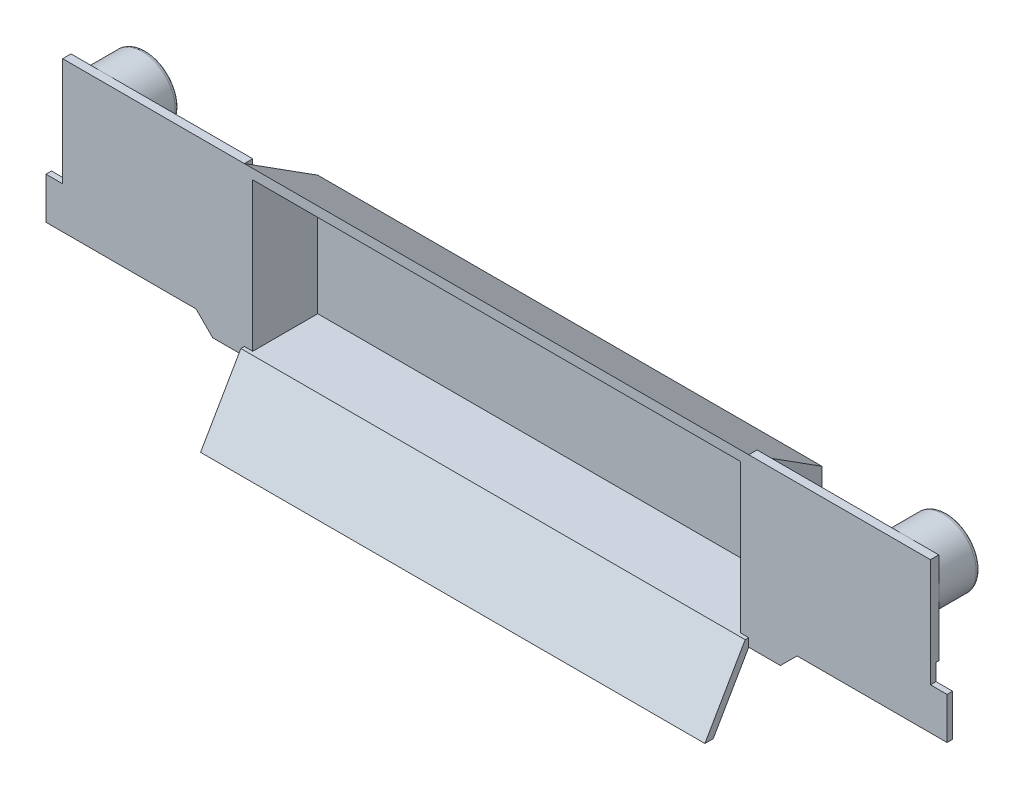
from build123d import *

# Parameters (mm, degrees)
Y_KSEKLIK_EKSTR_ZYON1_DEPTH = 1815
BO_ALTMA1_START             = 30
BO_ALTMA1_DEPTH             = 1755
Y_KSEKLIK_EKSTR_ZYON2_DEPTH = 30
IZIM3_R                     = 120
IZIM3_R_2                   = 90
Y_KSEKLIK_EKSTR_ZYON3_DEPTH = 150
IZIM4_R                     = 45
Y_KSEKLIK_EKSTR_ZYON4_DEPTH = 70
Y_KSEKLIK_EKSTR_ZYON5_DEPTH = 60
Y_KSEKLIK_EKSTR_ZYON6_DEPTH = 70
RADYUS1_R                   = 15
RADYUS2_R                   = 10
RADYUS3_R                   = 5
KES_EKSTR_ZYON1_DEPTH       = 10


# Read off the part's stored shape, not the designer's step: İç Boşaltma1
with BuildPart() as part:
    # Çizim1 → Yükseklik-Ekstrüzyon1 (new body)
    with BuildSketch(Plane(origin=(0, 0, 0), x_dir=(0, 0, -1), z_dir=(1, 0, 0))):
        Polygon((0, 0), (264, 0), (264, 432), (0, 600), (0, 30), (-12.701705922, 30), (-157.702213998, -221.14824711), (-127.68, -221.14824711), align=None)
    extrude(amount=Y_KSEKLIK_EKSTR_ZYON1_DEPTH)

    # İç Boşaltma1 outline → İç Boşaltma1 (cut)
    with BuildSketch(Plane.YZ.offset(BO_ALTMA1_START)):
        Polygon((564.440714153, 0), (30, 0), (30, -234), (415.531623244, -234), align=None)
    extrude(amount=BO_ALTMA1_DEPTH, mode=Mode.SUBTRACT)

    # Çizim2 → Yükseklik-Ekstrüzyon2 (add)
    with BuildSketch(Plane.XY):
        Polygon((1815, 600), (2469, 600), (2469, 210), (2529, 210), (2529, 60), (1989, 60), (1929, 0), (1815, 0), align=None)
        Polygon((0, 600), (0, 0), (-114, 0), (-174, 60), (-714, 60), (-714, 210), (-654, 210), (-654, 600), align=None)
    extrude(amount=-Y_KSEKLIK_EKSTR_ZYON2_DEPTH)



with BuildPart() as body_2:
    # Çizim3 → Yükseklik-Ekstrüzyon3 (new body)
    with BuildSketch(Plane(origin=(0, 0, -30), x_dir=(-1, 0, 0), z_dir=(0, 0, -1))):
        with Locations((-2349, 480)):
            Circle(IZIM3_R)
        with Locations((-2349, 480)):
            Circle(IZIM3_R_2, mode=Mode.SUBTRACT)
    extrude(amount=Y_KSEKLIK_EKSTR_ZYON3_DEPTH)


with BuildPart() as part_1:
    add(part.part)

    add(body_2.part)  # Yükseklik-Ekstrüzyon4 merges body 2
    # Çizim4 → Yükseklik-Ekstrüzyon4 (add)
    with BuildSketch(Plane(origin=(0, 0, -30), x_dir=(-1, 0, 0), z_dir=(0, 0, -1))):
        with Locations((-2349, 510)):
            Circle(IZIM4_R)
    extrude(amount=Y_KSEKLIK_EKSTR_ZYON4_DEPTH)

    # Çizim4<3> → Yükseklik-Ekstrüzyon5 (add)
    with BuildSketch(Plane(origin=(0, 0, -30), x_dir=(-1, 0, 0), z_dir=(0, 0, -1))):
        with BuildLine():
            Line((-2304, 430), (-2304, 510))
            ThreePointArc((-2304, 510), (-2349, 465), (-2394, 510))
            Line((-2394, 510), (-2394, 430))
            Line((-2394, 430), (-2349, 405))
            Line((-2349, 405), (-2304, 430))
        make_face()
    extrude(amount=Y_KSEKLIK_EKSTR_ZYON5_DEPTH)

    # Çizim5 → Yükseklik-Ekstrüzyon6 (add)
    with BuildSketch(Plane(origin=(0, 0, -30), x_dir=(-1, 0, 0), z_dir=(0, 0, -1))):
        with BuildLine():
            ThreePointArc((-2394, 440), (-2402.6187091, 424.928722701), (-2385.258427239, 425.143570688))
            Line((-2385.258427239, 425.143570688), (-2394, 430))
            Line((-2394, 430), (-2394, 440))
        make_face()
        with BuildLine():
            Line((-2394, 430), (-2385.258427239, 425.143570688))
            ThreePointArc((-2385.258427239, 425.143570688), (-2384.319717783, 427.491586917), (-2384, 430))
            ThreePointArc((-2384, 430), (-2386.928932188, 437.071067812), (-2394, 440))
            Line((-2394, 440), (-2394, 430))
        make_face()
        with BuildLine():
            ThreePointArc((-2312.741572761, 425.143570688), (-2301.491586917, 420.319717783), (-2294, 430))
            ThreePointArc((-2294, 430), (-2296.928932188, 437.071067812), (-2304, 440))
            Line((-2304, 440), (-2304, 430))
            Line((-2304, 430), (-2312.741572761, 425.143570688))
        make_face()
        with BuildLine():
            Line((-2304, 430), (-2304, 440))
            ThreePointArc((-2304, 440), (-2312.6187091, 435.071277299), (-2312.741572761, 425.143570688))
            Line((-2312.741572761, 425.143570688), (-2304, 430))
        make_face()
    extrude(amount=Y_KSEKLIK_EKSTR_ZYON6_DEPTH)

    # Radyus1
    radyus1_edges = [part_1.edges().sort_by_distance(p)[0] for p in [
        (2469, 480, -180),
    ]]
    fillet(radyus1_edges, radius=RADYUS1_R)

    # Radyus2
    radyus2_edges = [part_1.edges().sort_by_distance(p)[0] for p in [
        (2439, 480, -180),
    ]]
    fillet(radyus2_edges, radius=RADYUS2_R)

    # Radyus3
    radyus3_edges = [part_1.edges().sort_by_distance(p)[0] for p in [
        (2402.741572761, 434.856429312, -100),
        (2304, 420, -100),
        (2394, 510, -100),
    ]]
    fillet(radyus3_edges, radius=RADYUS3_R)

    # Aynalama17: part across plane


with BuildPart() as part_2:
    add(part_1.part)
    add(part_1.part.mirror(Plane.ZY.offset(-907.5)))

    # Çizim6 → Kes-Ekstrüzyon1 (cut)
    with BuildSketch(Plane(origin=(0, 0, -30), x_dir=(-1, 0, 0), z_dir=(0, 0, -1))):
        Polygon((-1989, 270), (-2469, 270), (-2469, 210), (-2529, 210), (-2529, 60), (-1989, 60), (-1929, 0), (-1872, 0), align=None)
    kes_ekstr_zyon1 = extrude(amount=-KES_EKSTR_ZYON1_DEPTH, mode=Mode.SUBTRACT)

    # Aynalama18: Kes-Ekstrüzyon1 across plane
    add(kes_ekstr_zyon1.mirror(Plane.ZY.offset(-907.5)), mode=Mode.SUBTRACT)


solid = part_2.part
